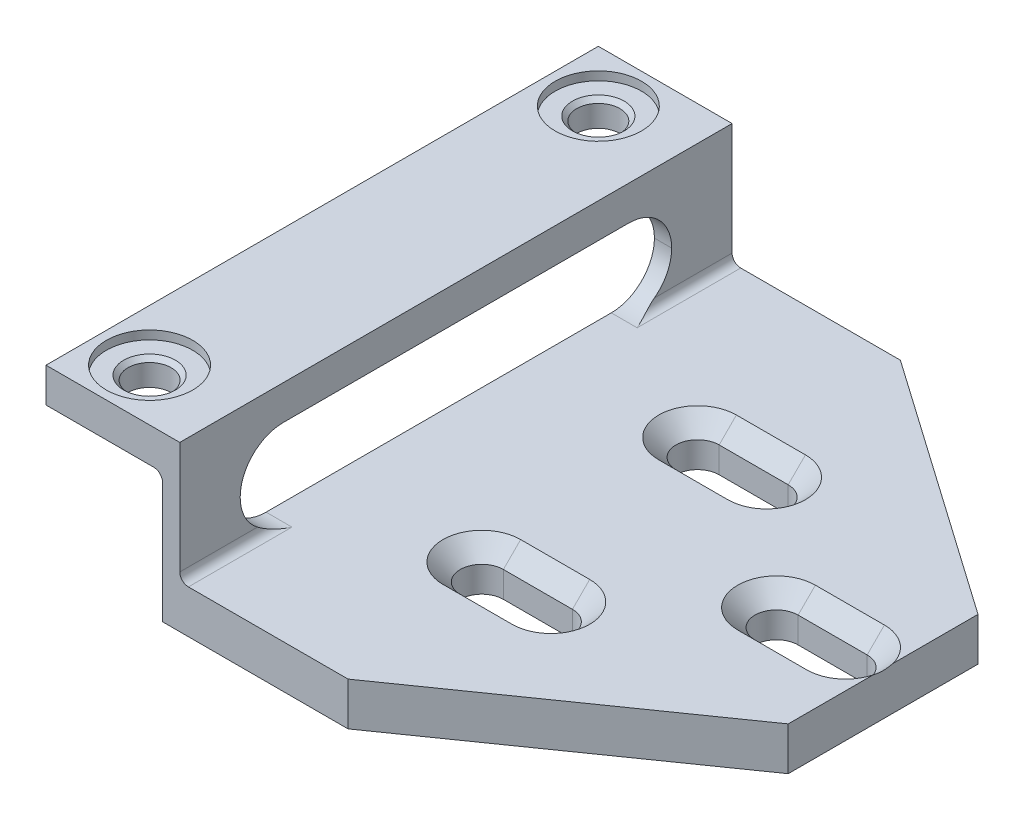
from build123d import *

# Parameters (mm, degrees)
SKETCH1_R           = 3.175
BOSS_EXTRUDE1_DEPTH = 6.35
SKETCH10_W          = 19.685
SKETCH10_H          = 81.28
SKETCH10_R          = 3.175
BOSS_EXTRUDE4_DEPTH = 17.78
SKETCH12_W          = 17.145
SKETCH12_H          = 81.28
CUT_EXTRUDE5_DEPTH  = 12.7
SKETCH14_R          = 6.35
CUT_EXTRUDE9_DEPTH  = 1.27
CHAMFER2_SIZE       = 0.635
SKETCH15_W          = 63.5
SKETCH15_H          = 12.7
CUT_EXTRUDE10_DEPTH = 36.576
SKETCH16_W          = 17.145
SKETCH16_H          = 6.35
CUT_EXTRUDE11_DEPTH = 84.836
FILLET1_R           = 1.27
FILLET2_START       = -31.75
FILLET2_DEPTH       = 6.3500001
FILLET2_START_2     = 25.3999999
FILLET2_2_DEPTH     = 6.3500001
FILLET2_START_3     = -30
FILLET2_3_DEPTH     = 6.505


with BuildPart() as part:
    # Sketch1 → Boss-Extrude1 (new body)
    with BuildSketch(Plane(origin=(0, 0, 0), x_dir=(1, 0, 0), z_dir=(0, 1, 0))):
        Polygon((0, 40.64), (38.1, 13.962092794), (38.1, -13.962092794), (0, -40.64), (-44.45, -40.64), (-44.45, 40.64), align=None)
        with Locations(Location((-36.83, 33.02, 0), (0, 0, 270))):
            Circle(SKETCH1_R, mode=Mode.SUBTRACT)
        with Locations(Location((-36.83, -33.02, 0), (0, 0, 270))):
            Circle(SKETCH1_R, mode=Mode.SUBTRACT)
        with BuildLine():
            Line((-5.08, 19.05), (5.08, 19.05))
            ThreePointArc((5.08, 19.05), (8.255, 15.875), (5.08, 12.7))
            Line((5.08, 12.7), (-5.08, 12.7))
            ThreePointArc((-5.08, 12.7), (-8.255, 15.875), (-5.08, 19.05))
        make_face(mode=Mode.SUBTRACT)
        with BuildLine():
            Line((-5.08, -12.7), (5.08, -12.7))
            ThreePointArc((5.08, -12.7), (8.255, -15.875), (5.08, -19.05))
            Line((5.08, -19.05), (-5.08, -19.05))
            ThreePointArc((-5.08, -19.05), (-8.255, -15.875), (-5.08, -12.7))
        make_face(mode=Mode.SUBTRACT)
        with BuildLine():
            Line((22.41630657, 3.175), (32.57630657, 3.175))
            ThreePointArc((32.57630657, 3.175), (35.75130657, 0), (32.57630657, -3.175))
            Line((32.57630657, -3.175), (22.41630657, -3.175))
            ThreePointArc((22.41630657, -3.175), (19.24130657, 0), (22.41630657, 3.175))
        make_face(mode=Mode.SUBTRACT)
    extrude(amount=BOSS_EXTRUDE1_DEPTH)

    # Sketch10 → Boss-Extrude4 (add)
    with BuildSketch(Plane(origin=(0, 6.35, 0), x_dir=(1, 0, 0), z_dir=(0, 1, 0))):
        with Locations((-34.6075, 0)):
            Rectangle(SKETCH10_W, SKETCH10_H)
        with Locations(Location((-36.83, -33.02, 0), (0, 0, 270))):
            Circle(SKETCH10_R, mode=Mode.SUBTRACT)
        with Locations(Location((-36.83, 33.02, 0), (0, 0, 270))):
            Circle(SKETCH10_R, mode=Mode.SUBTRACT)
    extrude(amount=BOSS_EXTRUDE4_DEPTH)

    # Sketch12 → Cut-Extrude5 (cut)
    with BuildSketch(Plane.XZ):
        with Locations((-35.8775, 0)):
            Rectangle(SKETCH12_W, SKETCH12_H)
    extrude(amount=-CUT_EXTRUDE5_DEPTH, mode=Mode.SUBTRACT)

    # Sketch14 → Cut-Extrude9 (cut)
    with BuildSketch(Plane(origin=(0, 24.13, 0), x_dir=(1, 0, 0), z_dir=(0, 1, 0))):
        with Locations(Location((-36.83, 33.02, 0), (0, 0, 270))):
            Circle(SKETCH14_R)
        with Locations(Location((-36.83, -33.02, 0), (0, 0, 270))):
            Circle(SKETCH14_R)
    extrude(amount=-CUT_EXTRUDE9_DEPTH, mode=Mode.SUBTRACT)

    # Chamfer2
    chamfer2_edges = [part.edges().sort_by_distance(p)[0] for p in [
        (-36.83, 22.86, -36.195),
        (-36.83, 22.86, 29.845),
    ]]
    chamfer(chamfer2_edges, length=CHAMFER2_SIZE)

    # Sketch15 → Cut-Extrude10 (cut)
    with BuildSketch(Plane(origin=(-24.765, 0, 0), x_dir=(0, 0, -1), z_dir=(1, 0, 0))):
        with Locations((0, 12.7)):
            Rectangle(SKETCH15_W, SKETCH15_H)
    extrude(amount=-CUT_EXTRUDE10_DEPTH, mode=Mode.SUBTRACT)

    # Sketch16 → Cut-Extrude11 (cut)
    with BuildSketch(Plane(origin=(0, 0, -40.64), x_dir=(-1, 0, 0), z_dir=(0, 0, -1))):
        with Locations((35.8775, 15.875)):
            Rectangle(SKETCH16_W, SKETCH16_H)
    extrude(amount=-CUT_EXTRUDE11_DEPTH, mode=Mode.SUBTRACT)

    # Fillet1
    fillet1_edges = [part.edges().sort_by_distance(p)[0] for p in [
        (-24.765, 6.35, -36.195),
        (-27.305, 19.05, 36.195),
        (-27.305, 19.05, -36.195),
        (-24.765, 6.35, 36.195),
    ]]
    fillet(fillet1_edges, radius=FILLET1_R)

    # Fillet2: read off the stored shape, not the designer's step
    # Fillet2 outline → Fillet2 (add)
    with BuildSketch(Plane.XY.offset(FILLET2_START)):
        with BuildLine():
            ThreePointArc((-23.495, 6.35), (-24.393025612, 6.721974388), (-24.765, 7.62))
            Line((-24.765, 7.62), (-24.765, 19.05))
            Line((-24.765, 19.05), (-28.575, 19.05))
            ThreePointArc((-28.575, 19.05), (-27.676974388, 18.678025612), (-27.305, 17.78))
            Line((-27.305, 17.78), (-27.305, 6.35))
            Line((-27.305, 6.35), (-23.495, 6.35))
        make_face()
    extrude(amount=FILLET2_DEPTH)

    # Fillet2 2 outline → Fillet2 2 (add)
    with BuildSketch(Plane.XY.offset(FILLET2_START_2)):
        with BuildLine():
            ThreePointArc((-23.495, 6.35), (-24.393025612, 6.721974388), (-24.765, 7.62))
            Line((-24.765, 7.62), (-24.765, 19.05))
            Line((-24.765, 19.05), (-28.575, 19.05))
            ThreePointArc((-28.575, 19.05), (-27.676974388, 18.678025612), (-27.305, 17.78))
            Line((-27.305, 17.78), (-27.305, 6.35))
            Line((-27.305, 6.35), (-23.495, 6.35))
        make_face()
    extrude(amount=FILLET2_2_DEPTH)

    # Fillet2 3 outline → Fillet2 3 (cut)
    with BuildSketch(Plane.YZ.offset(FILLET2_START_3)):
        with BuildLine():
            ThreePointArc((19.05, 25.4), (17.190128061, 29.890128061), (12.7, 31.75))
            ThreePointArc((12.7, 31.75), (8.209871939, 29.890128061), (6.35, 25.4))
            Line((6.35, 25.4), (19.05, 25.4))
        make_face()
        with BuildLine():
            ThreePointArc((12.7, -31.75), (17.190128061, -29.890128061), (19.05, -25.4))
            Line((19.05, -25.4), (6.35, -25.4))
            ThreePointArc((6.35, -25.4), (8.209871939, -29.890128061), (12.7, -31.75))
        make_face()
    extrude(amount=FILLET2_3_DEPTH, mode=Mode.SUBTRACT)

    # Chamfer3: read off the stored shape, not the designer's step
    # Chamfer3: loft between two sections, ruled curve by curve
    chamfer3_from = [
        Edge.make_three_point_arc((-5.08, 3.81, 12.7), (-7.32506403, 3.81, 13.62993597), (-8.255, 3.81, 15.875)),
        Edge.make_three_point_arc((-8.255, 3.81, 15.875), (-7.32506403, 3.81, 18.12006403), (-5.08, 3.81, 19.05)),
        Edge.make_three_point_arc((5.08, 3.81, 19.05), (7.32506403, 3.81, 18.12006403), (8.255, 3.81, 15.875)),
        Edge.make_three_point_arc((8.255, 3.81, 15.875), (7.32506403, 3.81, 13.62993597), (5.08, 3.81, 12.7)),
        Edge.make_line((5.08, 3.81, 12.7), (-5.08, 3.81, 12.7)),
        Edge.make_line((-5.08, 3.81, 19.05), (5.08, 3.81, 19.05)),
    ]
    chamfer3_to = [
        Edge.make_three_point_arc((-5.08, 6.35, 10.16), (-9.121115254, 6.35, 11.833884746), (-10.795, 6.35, 15.875)),
        Edge.make_three_point_arc((-10.795, 6.35, 15.875), (-9.121115254, 6.35, 19.916115254), (-5.08, 6.35, 21.59)),
        Edge.make_three_point_arc((5.08, 6.35, 21.59), (9.121115254, 6.35, 19.916115254), (10.795, 6.35, 15.875)),
        Edge.make_three_point_arc((10.795, 6.35, 15.875), (9.121115254, 6.35, 11.833884746), (5.08, 6.35, 10.16)),
        Edge.make_line((5.08, 6.35, 10.16), (-5.08, 6.35, 10.16)),
        Edge.make_line((-5.08, 6.35, 21.59), (5.08, 6.35, 21.59)),
    ]
    chamfer3 = Solid(Shell([*[Face.make_surface_from_curves(chamfer3_from[k], chamfer3_to[k]) for k in range(6)], Face(Wire(chamfer3_from)), Face(Wire(chamfer3_to))]))
    add(chamfer3, mode=Mode.SUBTRACT)

    # Chamfer3 2: loft between two sections, ruled curve by curve
    chamfer3_2_from = [
        Edge.make_three_point_arc((22.41630657, 3.81, -3.175), (20.17124254, 3.81, -2.24506403), (19.24130657, 3.81, 0)),
        Edge.make_three_point_arc((19.24130657, 3.81, 0), (20.17124254, 3.81, 2.24506403), (22.41630657, 3.81, 3.175)),
        Edge.make_three_point_arc((32.57630657, 3.81, 3.175), (34.8213706, 3.81, 2.24506403), (35.75130657, 3.81, 0)),
        Edge.make_three_point_arc((35.75130657, 3.81, 0), (34.8213706, 3.81, -2.24506403), (32.57630657, 3.81, -3.175)),
        Edge.make_line((32.57630657, 3.81, -3.175), (22.41630657, 3.81, -3.175)),
        Edge.make_line((22.41630657, 3.81, 3.175), (32.57630657, 3.81, 3.175)),
    ]
    chamfer3_2_to = [
        Edge.make_three_point_arc((22.41630657, 6.35, -5.715), (18.375191316, 6.35, -4.041115254), (16.70130657, 6.35, 0)),
        Edge.make_three_point_arc((16.70130657, 6.35, 0), (18.375191316, 6.35, 4.041115254), (22.41630657, 6.35, 5.715)),
        Edge.make_three_point_arc((32.57630657, 6.35, 5.715), (36.617421825, 6.35, 4.041115254), (38.29130657, 6.35, 0)),
        Edge.make_three_point_arc((38.29130657, 6.35, 0), (36.617421825, 6.35, -4.041115254), (32.57630657, 6.35, -5.715)),
        Edge.make_line((32.57630657, 6.35, -5.715), (22.41630657, 6.35, -5.715)),
        Edge.make_line((22.41630657, 6.35, 5.715), (32.57630657, 6.35, 5.715)),
    ]
    chamfer3_2 = Solid(Shell([*[Face.make_surface_from_curves(chamfer3_2_from[k], chamfer3_2_to[k]) for k in range(6)], Face(Wire(chamfer3_2_from)), Face(Wire(chamfer3_2_to))]))
    add(chamfer3_2, mode=Mode.SUBTRACT)

    # Chamfer3 3: loft between two sections, ruled curve by curve
    chamfer3_3_from = [
        Edge.make_three_point_arc((-5.08, 3.81, -19.05), (-7.32506403, 3.81, -18.12006403), (-8.255, 3.81, -15.875)),
        Edge.make_three_point_arc((-8.255, 3.81, -15.875), (-7.32506403, 3.81, -13.62993597), (-5.08, 3.81, -12.7)),
        Edge.make_three_point_arc((5.08, 3.81, -12.7), (7.32506403, 3.81, -13.62993597), (8.255, 3.81, -15.875)),
        Edge.make_three_point_arc((8.255, 3.81, -15.875), (7.32506403, 3.81, -18.12006403), (5.08, 3.81, -19.05)),
        Edge.make_line((5.08, 3.81, -19.05), (-5.08, 3.81, -19.05)),
        Edge.make_line((-5.08, 3.81, -12.7), (5.08, 3.81, -12.7)),
    ]
    chamfer3_3_to = [
        Edge.make_three_point_arc((-5.08, 6.35, -21.59), (-9.121115254, 6.35, -19.916115254), (-10.795, 6.35, -15.875)),
        Edge.make_three_point_arc((-10.795, 6.35, -15.875), (-9.121115254, 6.35, -11.833884746), (-5.08, 6.35, -10.16)),
        Edge.make_three_point_arc((5.08, 6.35, -10.16), (9.121115254, 6.35, -11.833884746), (10.795, 6.35, -15.875)),
        Edge.make_three_point_arc((10.795, 6.35, -15.875), (9.121115254, 6.35, -19.916115254), (5.08, 6.35, -21.59)),
        Edge.make_line((5.08, 6.35, -21.59), (-5.08, 6.35, -21.59)),
        Edge.make_line((-5.08, 6.35, -10.16), (5.08, 6.35, -10.16)),
    ]
    chamfer3_3 = Solid(Shell([*[Face.make_surface_from_curves(chamfer3_3_from[k], chamfer3_3_to[k]) for k in range(6)], Face(Wire(chamfer3_3_from)), Face(Wire(chamfer3_3_to))]))
    add(chamfer3_3, mode=Mode.SUBTRACT)


solid = part.part
